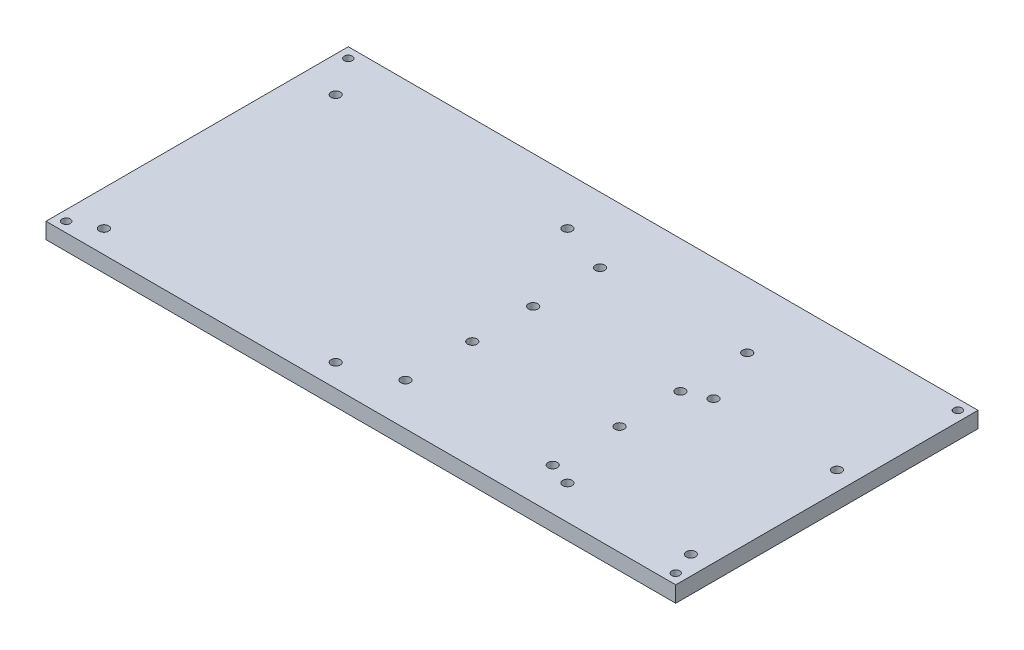
from build123d import *

# Parameters (mm, degrees)
SKETCH1_W                       = 250
SKETCH1_H                       = 120
BOSS_EXTRUDE1_DEPTH             = 6.35
F_3_0MM_CLEARANCE_DOWEL_HOLE2_D = 3.7
SKETCH6_R                       = 1.6
CUT_EXTRUDE1_DEPTH              = 139.799576728


with BuildPart() as part:
    # Sketch1 → Boss-Extrude1 (new body)
    with BuildSketch(Plane(origin=(0, 0, 0), x_dir=(1, 0, 0), z_dir=(0, 1, 0))):
        Rectangle(SKETCH1_W, SKETCH1_H)
    extrude(amount=BOSS_EXTRUDE1_DEPTH)

    # Ø3.0mm Clearance Dowel Hole2 (through all)
    with Locations(Plane(origin=(-51.313554622, 0, 70.400125598), x_dir=(-1, 0, 0), z_dir=(0, -1, 0))):
        with Locations((-52.288554622, 77.840125598), (-32.313554622, 111.400125598), (-52.288554622, 104.360125598), (-52.288554622, 53.660125598), (-52.288554622, 27.140125598), (-32.313554622, 19.400125598), (59.686445378, 19.400125598), (-110.738554622, 27.140125598), (-110.738554622, 53.660125598), (-110.738554622, 77.840125598), (-110.738554622, 104.360125598), (-168.813554622, 23.900125598), (-168.813554622, 81.900125598), (-119.813554622, 81.900125598), (-119.813554622, 23.900125598), (59.686445378, 111.400125598)):
            Hole(F_3_0MM_CLEARANCE_DOWEL_HOLE2_D / 2)

    # Sketch6 → Cut-Extrude1 (cut, through all)
    with BuildSketch(Plane(origin=(0, 6.35, 0), x_dir=(1, 0, 0), z_dir=(0, 1, 0))):
        with Locations((-121, 56)):
            Circle(SKETCH6_R)
        with Locations((-121, -56)):
            Circle(SKETCH6_R)
        with Locations((121, -56)):
            Circle(SKETCH6_R)
        with Locations((121, 56)):
            Circle(SKETCH6_R)
    extrude(amount=-CUT_EXTRUDE1_DEPTH, mode=Mode.SUBTRACT)


solid = part.part
